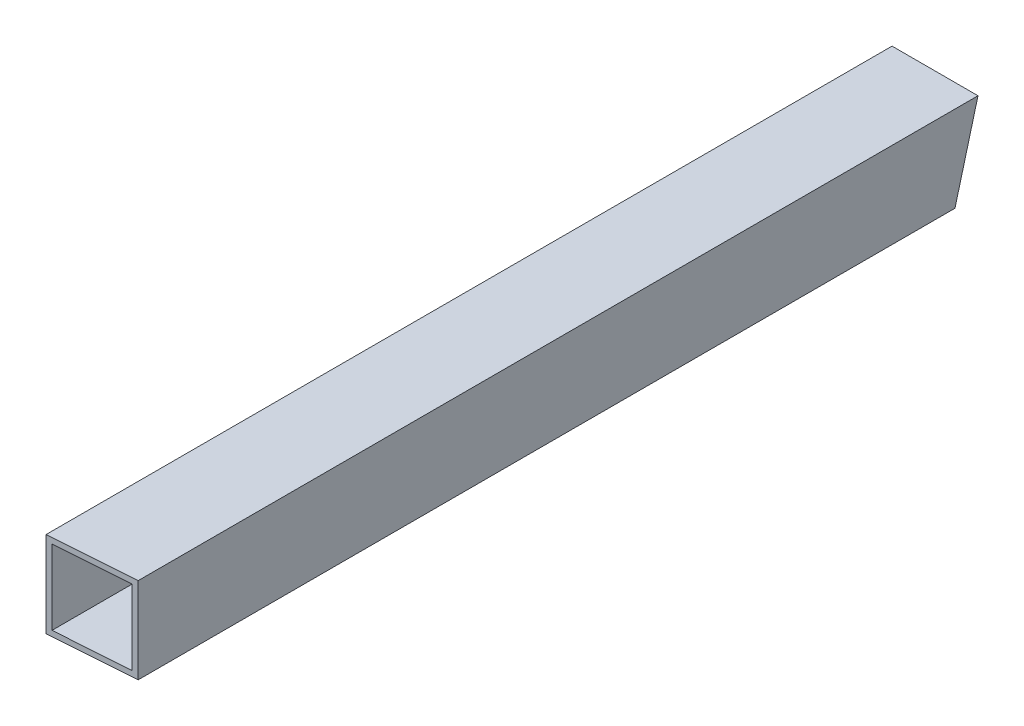
from build123d import *

# Parameters (mm, degrees)
SKETCH6_W           = 25.4
SKETCH6_H           = 25.4
BOSS_EXTRUDE1_DEPTH = 250
CUT_EXTRUDE2_DEPTH  = 253.567456336
SHELL1_T            = -1.651
CUT_EXTRUDE3_DEPTH  = 253.567456336


with BuildPart() as part:
    # Sketch6 → Boss-Extrude1 (new body)
    with BuildSketch(Plane.XY):
        with Locations((12.7, -12.7)):
            Rectangle(SKETCH6_W, SKETCH6_H)
    extrude(amount=BOSS_EXTRUDE1_DEPTH)

    # Sketch7 → Cut-Extrude2 (cut, through all)
    with BuildSketch(Plane(origin=(0, 0, 0), x_dir=(1, 0, 0), z_dir=(0, 1, 0))):
        Polygon((0, -250), (25.4, -248.180583461), (25.4, -250), align=None)
    extrude(amount=-CUT_EXTRUDE2_DEPTH, mode=Mode.SUBTRACT)

    # Shell1
    shell1_openings = [part.faces().sort_by_distance(p)[0] for p in [
        (12.7, -12.7, 249.090291731),
        (12.7, -12.7, 0),
    ]]
    offset(amount=SHELL1_T, openings=shell1_openings, kind=Kind.INTERSECTION)

    # Sketch9 → Cut-Extrude3 (cut, through all)
    with BuildSketch(Plane.ZY):
        Polygon((0, 0), (6.805909488, -25.4), (0, -25.4), align=None)
    extrude(amount=-CUT_EXTRUDE3_DEPTH, mode=Mode.SUBTRACT)


solid = part.part
